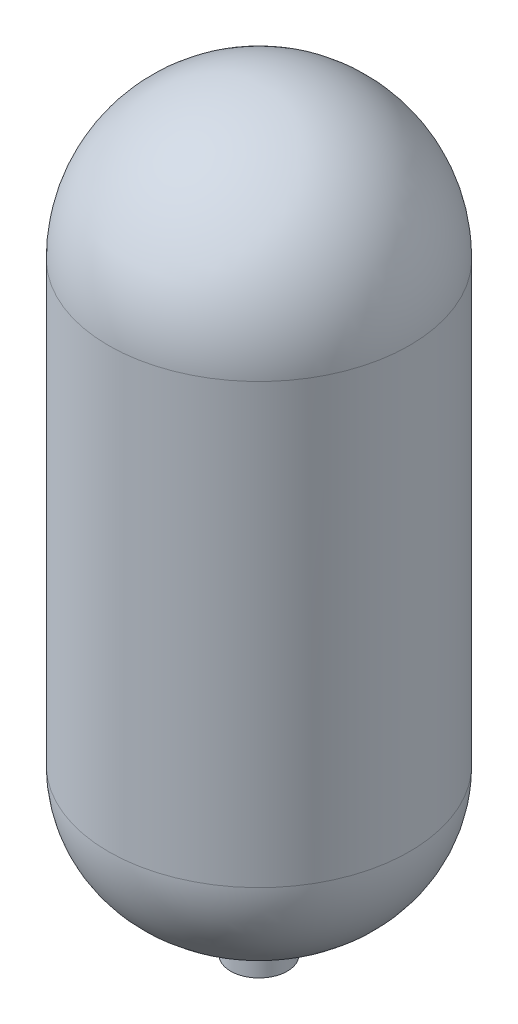
from build123d import *


# Read off the part's stored shape, not the designer's step: Shell1
with BuildPart() as part:
    # Sketch1 → Revolve1 (revolve)
    with BuildSketch(Plane.XY, mode=Mode.PRIVATE) as revolve1_sk:
        with BuildLine():
            Line((0, 169), (0, -169))
            Line((0, -169), (-12.7, -169))
            Line((-12.7, -169), (-12.7, -149.95))
            ThreePointArc((-12.7, -149.95), (-51.449451609, -133.899451609), (-67.5, -95.15))
            Line((-67.5, -95.15), (-67.5, 101.5))
            ThreePointArc((-67.5, 101.5), (-47.72970773, 149.22970773), (0, 169))
        make_face()
    revolve(revolve1_sk.sketch.rotate(Axis((0, 169, 0), (0, -1, 0)), 270), axis=Axis((0, 169, 0), (0, -1, 0)))

    # Shell1 outline → Shell1 (revolve, cut)
    with BuildSketch(Plane.XY):
        with BuildLine():
            Line((64.325, -95.15), (64.325, 101.499999979))
            ThreePointArc((64.325, 101.499999979), (45.484643708, 146.984643692), (0, 165.825))
            Line((0, 165.825), (0, -169))
            Line((0, -169), (9.525, -169))
            Line((9.525, -169), (9.525, -146.677274331))
            ThreePointArc((9.525, -146.677274331), (48.06404424, -132.760171497), (64.325, -95.15))
        make_face()
    revolve(axis=Axis((0, 0, 0), (0, 1, 0)), mode=Mode.SUBTRACT)


solid = part.part
